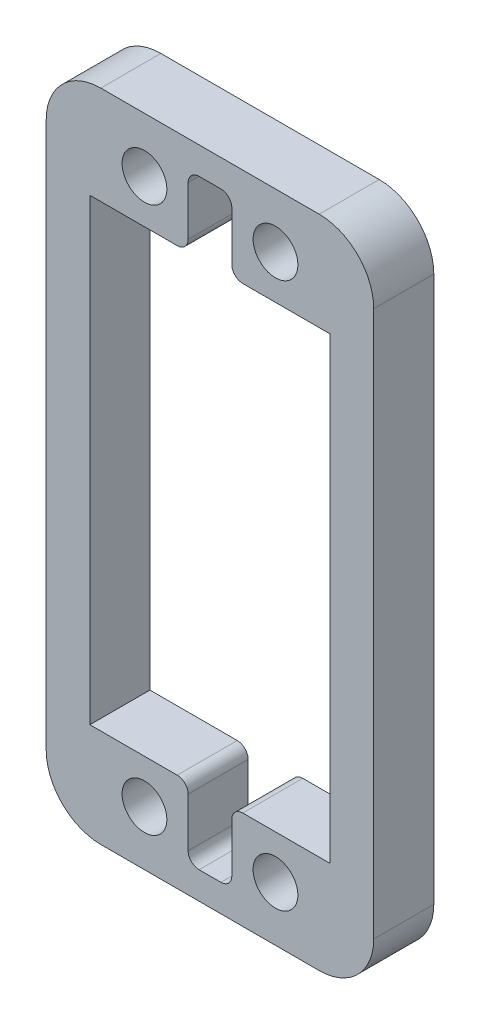
from build123d import *

# Parameters (mm, degrees)
CROQUIS1_W              = 30
CROQUIS1_H              = 60
SALIENTE_EXTRUIR1_DEPTH = 5.5
CROQUIS2_W              = 22
CROQUIS2_H              = 42
CORTAR_EXTRUIR1_DEPTH   = 34.988968799
CROQUIS3_R              = 2.05
CORTAR_EXTRUIR2_DEPTH   = 34.988968799
REDONDEO1_R             = 5
REDONDEO3_R             = 1


with BuildPart() as part:
    # Croquis1 → Saliente-Extruir1 (new body)
    with BuildSketch(Plane.XY):
        Rectangle(CROQUIS1_W, CROQUIS1_H)
    extrude(amount=SALIENTE_EXTRUIR1_DEPTH)

    # Croquis2 → Cortar-Extruir1 (cut, through all)
    with BuildSketch(Plane(origin=(0, 0, 0), x_dir=(-1, 0, 0), z_dir=(0, 0, -1))):
        Rectangle(CROQUIS2_W, CROQUIS2_H)
    extrude(amount=-CORTAR_EXTRUIR1_DEPTH, mode=Mode.SUBTRACT)

    # Croquis3 → Cortar-Extruir2 (cut, through all)
    with BuildSketch(Plane(origin=(0, 0, 0), x_dir=(-1, 0, 0), z_dir=(0, 0, -1))):
        with Locations((-6, 25)):
            Circle(CROQUIS3_R)
        with Locations((6, 25)):
            Circle(CROQUIS3_R)
        with Locations((-6, -25)):
            Circle(CROQUIS3_R)
        with Locations((6, -25)):
            Circle(CROQUIS3_R)
        Polygon((-2, 21), (-2, 27.5), (2, 27.5), (2, -27.5), (-2, -27.5), align=None)
    extrude(amount=-CORTAR_EXTRUIR2_DEPTH, mode=Mode.SUBTRACT)

    # Redondeo1
    redondeo1_edges = [part.edges().sort_by_distance(p)[0] for p in [
        (-15, -30, 2.75),
        (15, -30, 2.75),
        (15, 30, 2.75),
        (-15, 30, 2.75),
    ]]
    fillet(redondeo1_edges, radius=REDONDEO1_R)

    # Redondeo3
    redondeo3_edges = [part.edges().sort_by_distance(p)[0] for p in [
        (-2, -27.5, 2.75),
        (-2, -21, 2.75),
        (2, -21, 2.75),
        (2, -27.5, 2.75),
        (2, 27.5, 2.75),
        (-2, 27.5, 2.75),
        (2, 21, 2.75),
        (-2, 21, 2.75),
    ]]
    fillet(redondeo3_edges, radius=REDONDEO3_R)


solid = part.part
